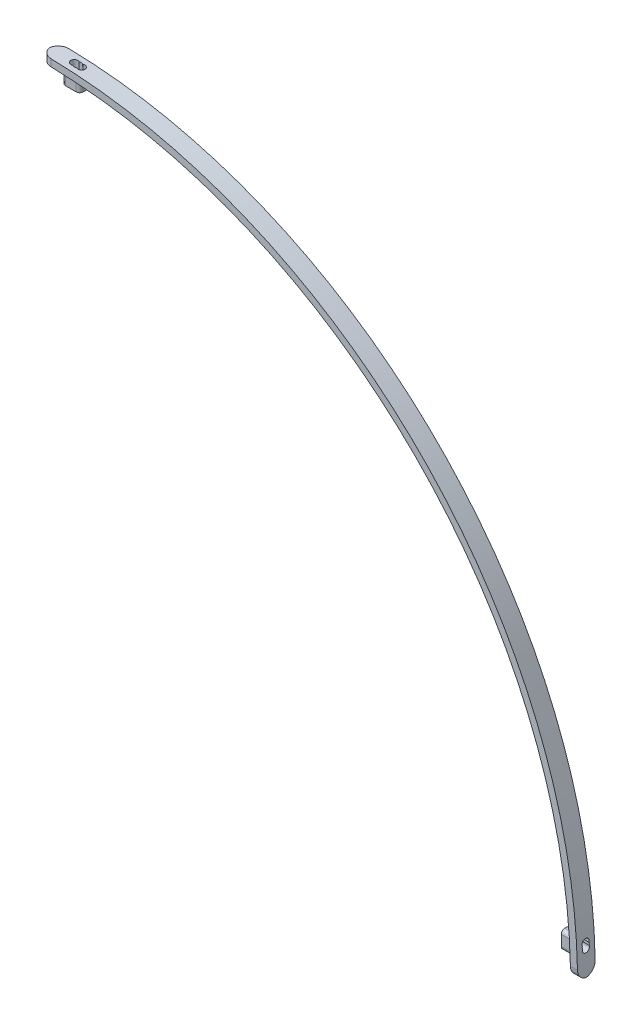
from build123d import *

# Parameters (mm, degrees)
SKETCH2_W               = 2
SKETCH2_H               = 5
REVOLVE1_ANGLE          = 90
FILLET1_R               = 3
CUT_EXTRUDE3_DEPTH      = 215.550755161
CUT_EXTRUDE3_DEPTH_BACK = 215.550755161
SKETCH6_R               = 1
CUT_EXTRUDE4_DEPTH      = 215.550755161
CUT_EXTRUDE4_DEPTH_BACK = 215.550755161
SKETCH8_R               = 1
BOSS_EXTRUDE1_START     = 146.6
BOSS_EXTRUDE1_DEPTH     = 3.5
CUT_EXTRUDE5_DEPTH      = 214.392955928
CUT_EXTRUDE5_DEPTH_BACK = 214.392955928
BOSS_EXTRUDE2_START     = 146.6
BOSS_EXTRUDE2_DEPTH     = 3.5
CUT_EXTRUDE6_DEPTH      = 214.39295592
CUT_EXTRUDE6_DEPTH_BACK = 214.39295592


with BuildPart() as part:
    # Sketch2 → Revolve1 (revolve)
    with BuildSketch(Plane(origin=(0, 0, 0), x_dir=(1, 0, 0), z_dir=(0, 1, 0))):
        with Locations((150.7, 0)):
            Rectangle(SKETCH2_W, SKETCH2_H)
    revolve(axis=Axis((0, 0, -100.384215514), (0, 0, 1)), revolution_arc=REVOLVE1_ANGLE)

    # Fillet1
    # the kernel refuses this fillet: 3 mm, written as the material it takes off along each edge
    with BuildSketch(Plane(origin=(0, 142.2, -2.5), x_dir=(1, 0, 0), z_dir=(0, 1, 0))) as fillet1_piece_1_section:
        with BuildLine():
            CenterArc((FILLET1_R, -FILLET1_R), FILLET1_R, 90, 90)
            Line((0, -FILLET1_R), (-FILLET1_R * 0.02, -FILLET1_R))
            Line((-FILLET1_R * 0.02, -FILLET1_R), (-FILLET1_R * 0.02, FILLET1_R * 0.02))
            Line((-FILLET1_R * 0.02, FILLET1_R * 0.02), (FILLET1_R, FILLET1_R * 0.02))
            Line((FILLET1_R, FILLET1_R * 0.02), (FILLET1_R, 0))
        make_face()
    fillet1_piece_1 = extrude(amount=17, mode=Mode.PRIVATE)
    fillet1_piece_1 = fillet1_piece_1 - Plane(origin=(0, 0, -1.820833187), x_dir=(1, 0, 0), z_dir=(0, 0, -1)) * Cylinder(149.7, 46, mode=Mode.PRIVATE)
    fillet1_piece_1 = fillet1_piece_1 & Plane(origin=(0, 0, -1.820833187), x_dir=(1, 0, 0), z_dir=(0, 0, 1)) * Cylinder(151.7, 46, mode=Mode.PRIVATE)
    with BuildSketch(Plane(origin=(0, 159.2, 2.5), x_dir=(1, 0, 0), z_dir=(0, -1, 0))) as fillet1_piece_2_section:
        with BuildLine():
            CenterArc((FILLET1_R, -FILLET1_R), FILLET1_R, 90, 90)
            Line((0, -FILLET1_R), (-FILLET1_R * 0.02, -FILLET1_R))
            Line((-FILLET1_R * 0.02, -FILLET1_R), (-FILLET1_R * 0.02, FILLET1_R * 0.02))
            Line((-FILLET1_R * 0.02, FILLET1_R * 0.02), (FILLET1_R, FILLET1_R * 0.02))
            Line((FILLET1_R, FILLET1_R * 0.02), (FILLET1_R, 0))
        make_face()
    fillet1_piece_2 = extrude(amount=17, mode=Mode.PRIVATE)
    fillet1_piece_2 = fillet1_piece_2 & Plane(origin=(0, 0, 1.820833187), x_dir=(1, 0, 0), z_dir=(0, 0, 1)) * Cylinder(151.7, 46, mode=Mode.PRIVATE)
    fillet1_piece_2 = fillet1_piece_2 - Plane(origin=(0, 0, 1.820833187), x_dir=(1, 0, 0), z_dir=(0, 0, -1)) * Cylinder(149.7, 46, mode=Mode.PRIVATE)
    with BuildSketch(Plane(origin=(142.2, 0, -2.5), x_dir=(0, 1, 0), z_dir=(1, 0, 0))) as fillet1_piece_3_section:
        with BuildLine():
            CenterArc((FILLET1_R, FILLET1_R), FILLET1_R, 180, 90)
            Line((0, FILLET1_R), (-FILLET1_R * 0.02, FILLET1_R))
            Line((-FILLET1_R * 0.02, FILLET1_R), (-FILLET1_R * 0.02, -FILLET1_R * 0.02))
            Line((-FILLET1_R * 0.02, -FILLET1_R * 0.02), (FILLET1_R, -FILLET1_R * 0.02))
            Line((FILLET1_R, -FILLET1_R * 0.02), (FILLET1_R, 0))
        make_face()
    fillet1_piece_3 = extrude(amount=17, mode=Mode.PRIVATE)
    fillet1_piece_3 = fillet1_piece_3 - Plane(origin=(0, 0, -1.820823807), x_dir=(1, 0, 0), z_dir=(0, 0, -1)) * Cylinder(149.7, 46, mode=Mode.PRIVATE)
    fillet1_piece_3 = fillet1_piece_3 & Plane(origin=(0, 0, -1.820823807), x_dir=(1, 0, 0), z_dir=(0, 0, 1)) * Cylinder(151.7, 46, mode=Mode.PRIVATE)
    with BuildSketch(Plane(origin=(159.2, 0, 2.5), x_dir=(0, 1, 0), z_dir=(-1, 0, 0))) as fillet1_piece_4_section:
        with BuildLine():
            CenterArc((FILLET1_R, FILLET1_R), FILLET1_R, 180, 90)
            Line((0, FILLET1_R), (-FILLET1_R * 0.02, FILLET1_R))
            Line((-FILLET1_R * 0.02, FILLET1_R), (-FILLET1_R * 0.02, -FILLET1_R * 0.02))
            Line((-FILLET1_R * 0.02, -FILLET1_R * 0.02), (FILLET1_R, -FILLET1_R * 0.02))
            Line((FILLET1_R, -FILLET1_R * 0.02), (FILLET1_R, 0))
        make_face()
    fillet1_piece_4 = extrude(amount=17, mode=Mode.PRIVATE)
    fillet1_piece_4 = fillet1_piece_4 & Plane(origin=(0, 0, 1.820823807), x_dir=(1, 0, 0), z_dir=(0, 0, 1)) * Cylinder(151.7, 46, mode=Mode.PRIVATE)
    fillet1_piece_4 = fillet1_piece_4 - Plane(origin=(0, 0, 1.820823807), x_dir=(1, 0, 0), z_dir=(0, 0, -1)) * Cylinder(149.7, 46, mode=Mode.PRIVATE)
    add([fillet1_piece_1, fillet1_piece_2, fillet1_piece_3, fillet1_piece_4], mode=Mode.SUBTRACT)

    # Sketch6 → Cut-Extrude3 (cut, two sides: drawn at the far end of the back side and taken through both)
    with BuildSketch(Plane(origin=(0, 0, 0), x_dir=(0, 0, -1), z_dir=(1, 0, 0)).offset(-CUT_EXTRUDE3_DEPTH_BACK)):
        with BuildLine():
            ThreePointArc((1, 8.4), (0.707106781, 9.107106781), (0, 9.4))
            Line((0, 9.4), (0, 8.7))
            ThreePointArc((0, 8.7), (0.570087713, 8.521583836), (0.9367497, 8.05))
            ThreePointArc((0.9367497, 8.05), (0.984060389, 8.222165385), (1, 8.4))
        make_face()
        with BuildLine():
            Line((0, 8.7), (0, 9.4))
            ThreePointArc((0, 9.4), (-0.821583836, 8.970087713), (-0.9367497, 8.05))
            ThreePointArc((-0.9367497, 8.05), (-0.570087713, 8.521583836), (0, 8.7))
        make_face()
        with BuildLine():
            ThreePointArc((1, 8.4), (0.707106781, 9.107106781), (0, 9.4))
            Line((0, 9.4), (0, 8.7))
            ThreePointArc((0, 8.7), (0.570087713, 8.521583836), (0.9367497, 8.05))
            ThreePointArc((0.9367497, 8.05), (0.984060389, 8.222165385), (1, 8.4))
        make_face()
        with BuildLine():
            Line((0, 8.7), (0, 9.4))
            ThreePointArc((0, 9.4), (-0.821583836, 8.970087713), (-0.9367497, 8.05))
            ThreePointArc((-0.9367497, 8.05), (-0.570087713, 8.521583836), (0, 8.7))
        make_face()
        with BuildLine():
            ThreePointArc((1, 8.4), (0.707106781, 9.107106781), (0, 9.4))
            Line((0, 9.4), (0, 8.7))
            ThreePointArc((0, 8.7), (0.570087713, 8.521583836), (0.9367497, 8.05))
            ThreePointArc((0.9367497, 8.05), (0.984060389, 8.222165385), (1, 8.4))
        make_face()
        with BuildLine():
            Line((0, 8.7), (0, 9.4))
            ThreePointArc((0, 9.4), (-0.821583836, 8.970087713), (-0.9367497, 8.05))
            ThreePointArc((-0.9367497, 8.05), (-0.570087713, 8.521583836), (0, 8.7))
        make_face()
        with BuildLine():
            ThreePointArc((1, 8.4), (0.707106781, 9.107106781), (0, 9.4))
            Line((0, 9.4), (0, 8.7))
            ThreePointArc((0, 8.7), (0.570087713, 8.521583836), (0.9367497, 8.05))
            ThreePointArc((0.9367497, 8.05), (0.984060389, 8.222165385), (1, 8.4))
        make_face()
        with BuildLine():
            Line((0, 8.7), (0, 9.4))
            ThreePointArc((0, 9.4), (-0.821583836, 8.970087713), (-0.9367497, 8.05))
            ThreePointArc((-0.9367497, 8.05), (-0.570087713, 8.521583836), (0, 8.7))
        make_face()
        with Locations((0, 8.4)):
            Circle(SKETCH6_R)
        with Locations((0, 7.7)):
            Circle(SKETCH6_R)
        with Locations((0, 7)):
            Circle(SKETCH6_R)
        with Locations((0, 8.4)):
            Circle(SKETCH6_R)
        with Locations((0, 7)):
            Circle(SKETCH6_R)
        with Locations((0, 7.7)):
            Circle(SKETCH6_R)
        with BuildLine():
            ThreePointArc((0, 6.7), (-0.570087713, 6.878416164), (-0.9367497, 7.35))
            ThreePointArc((-0.9367497, 7.35), (-0.821583836, 6.429912287), (0, 6))
            Line((0, 6), (0, 6.7))
        make_face()
        with BuildLine():
            Line((0, 6.7), (0, 6))
            ThreePointArc((0, 6), (0.707106781, 6.292893219), (1, 7))
            ThreePointArc((1, 7), (0.984060389, 7.177834615), (0.9367497, 7.35))
            ThreePointArc((0.9367497, 7.35), (0.570087713, 6.878416164), (0, 6.7))
        make_face()
        with BuildLine():
            ThreePointArc((0, 6.7), (-0.570087713, 6.878416164), (-0.9367497, 7.35))
            ThreePointArc((-0.9367497, 7.35), (-0.821583836, 6.429912287), (0, 6))
            Line((0, 6), (0, 6.7))
        make_face()
        with BuildLine():
            Line((0, 6.7), (0, 6))
            ThreePointArc((0, 6), (0.707106781, 6.292893219), (1, 7))
            ThreePointArc((1, 7), (0.984060389, 7.177834615), (0.9367497, 7.35))
            ThreePointArc((0.9367497, 7.35), (0.570087713, 6.878416164), (0, 6.7))
        make_face()
        with BuildLine():
            ThreePointArc((0, 6.7), (-0.570087713, 6.878416164), (-0.9367497, 7.35))
            ThreePointArc((-0.9367497, 7.35), (-0.821583836, 6.429912287), (0, 6))
            Line((0, 6), (0, 6.7))
        make_face()
        with BuildLine():
            Line((0, 6.7), (0, 6))
            ThreePointArc((0, 6), (0.707106781, 6.292893219), (1, 7))
            ThreePointArc((1, 7), (0.984060389, 7.177834615), (0.9367497, 7.35))
            ThreePointArc((0.9367497, 7.35), (0.570087713, 6.878416164), (0, 6.7))
        make_face()
        with BuildLine():
            ThreePointArc((0, 6.7), (-0.570087713, 6.878416164), (-0.9367497, 7.35))
            ThreePointArc((-0.9367497, 7.35), (-0.821583836, 6.429912287), (0, 6))
            Line((0, 6), (0, 6.7))
        make_face()
        with BuildLine():
            Line((0, 6.7), (0, 6))
            ThreePointArc((0, 6), (0.707106781, 6.292893219), (1, 7))
            ThreePointArc((1, 7), (0.984060389, 7.177834615), (0.9367497, 7.35))
            ThreePointArc((0.9367497, 7.35), (0.570087713, 6.878416164), (0, 6.7))
        make_face()
    extrude(amount=CUT_EXTRUDE3_DEPTH + CUT_EXTRUDE3_DEPTH_BACK, mode=Mode.SUBTRACT)

    # Sketch8 → Cut-Extrude4 (cut, two sides: drawn at the far end of the back side and taken through both)
    with BuildSketch(Plane(origin=(0, 0, 0), x_dir=(1, 0, 0), z_dir=(0, 1, 0)).offset(-CUT_EXTRUDE4_DEPTH_BACK)):
        with Locations((7.041960108, 0)):
            Circle(SKETCH8_R)
        with Locations((8.041960108, 0)):
            Circle(SKETCH8_R)
        with Locations((9.041960108, 0)):
            Circle(SKETCH8_R)
    extrude(amount=CUT_EXTRUDE4_DEPTH + CUT_EXTRUDE4_DEPTH_BACK, mode=Mode.SUBTRACT)

    # Sketch9 → Boss-Extrude1 (add)
    with BuildSketch(Plane(origin=(0, 0, 0), x_dir=(0, 0, -1), z_dir=(1, 0, 0)).offset(BOSS_EXTRUDE1_START)):
        with BuildLine():
            Line((-1, 10.041960108), (1, 10.041960108))
            ThreePointArc((1, 10.041960108), (1.707106781, 9.74906689), (2, 9.041960108))
            Line((2, 9.041960108), (2, 6.041960108))
            ThreePointArc((2, 6.041960108), (1.707106781, 5.334853327), (1, 5.041960108))
            Line((1, 5.041960108), (-1, 5.041960108))
            ThreePointArc((-1, 5.041960108), (-1.707106781, 5.334853327), (-2, 6.041960108))
            Line((-2, 6.041960108), (-2, 9.041960108))
            ThreePointArc((-2, 9.041960108), (-1.707106781, 9.74906689), (-1, 10.041960108))
        make_face()
    extrude(amount=BOSS_EXTRUDE1_DEPTH)

    # Sketch10 → Cut-Extrude5 (cut, two sides: drawn at the far end of the back side and taken through both)
    with BuildSketch(Plane(origin=(150.1, 0, 0), x_dir=(0, 0, -1), z_dir=(1, 0, 0)).offset(-CUT_EXTRUDE5_DEPTH_BACK)):
        with BuildLine():
            ThreePointArc((-0.9367497, 7.35), (0, 6), (0.9367497, 7.35))
            ThreePointArc((0.9367497, 7.35), (1, 7.7), (0.9367497, 8.05))
            ThreePointArc((0.9367497, 8.05), (0, 9.4), (-0.9367497, 8.05))
            ThreePointArc((-0.9367497, 8.05), (-1, 7.7), (-0.9367497, 7.35))
        make_face()
    extrude(amount=CUT_EXTRUDE5_DEPTH + CUT_EXTRUDE5_DEPTH_BACK, mode=Mode.SUBTRACT)

    # Sketch11 → Boss-Extrude2 (add)
    with BuildSketch(Plane(origin=(0, 0, 0), x_dir=(1, 0, 0), z_dir=(0, 1, 0)).offset(BOSS_EXTRUDE2_START)):
        with BuildLine():
            Line((6.541960108, -2), (9.541960108, -2))
            ThreePointArc((9.541960108, -2), (10.24906689, -1.707106781), (10.541960108, -1))
            Line((10.541960108, -1), (10.541960108, 1))
            ThreePointArc((10.541960108, 1), (10.24906689, 1.707106781), (9.541960108, 2))
            Line((9.541960108, 2), (6.541960108, 2))
            ThreePointArc((6.541960108, 2), (5.834853327, 1.707106781), (5.541960108, 1))
            Line((5.541960108, 1), (5.541960108, -1))
            ThreePointArc((5.541960108, -1), (5.834853327, -1.707106781), (6.541960108, -2))
        make_face()
    extrude(amount=BOSS_EXTRUDE2_DEPTH)

    # Sketch12 → Cut-Extrude6 (cut, two sides: drawn at the far end of the back side and taken through both)
    with BuildSketch(Plane(origin=(0, 150.1, 0), x_dir=(1, 0, 0), z_dir=(0, 1, 0)).offset(-CUT_EXTRUDE6_DEPTH_BACK)):
        with BuildLine():
            ThreePointArc((7.541960108, -0.866025404), (8.041960108, -1), (8.541960108, -0.866025404))
            ThreePointArc((8.541960108, -0.866025404), (10.041960108, 0), (8.541960108, 0.866025404))
            ThreePointArc((8.541960108, 0.866025404), (8.041960108, 1), (7.541960108, 0.866025404))
            ThreePointArc((7.541960108, 0.866025404), (6.041960108, 0), (7.541960108, -0.866025404))
        make_face()
    extrude(amount=CUT_EXTRUDE6_DEPTH + CUT_EXTRUDE6_DEPTH_BACK, mode=Mode.SUBTRACT)


solid = part.part
